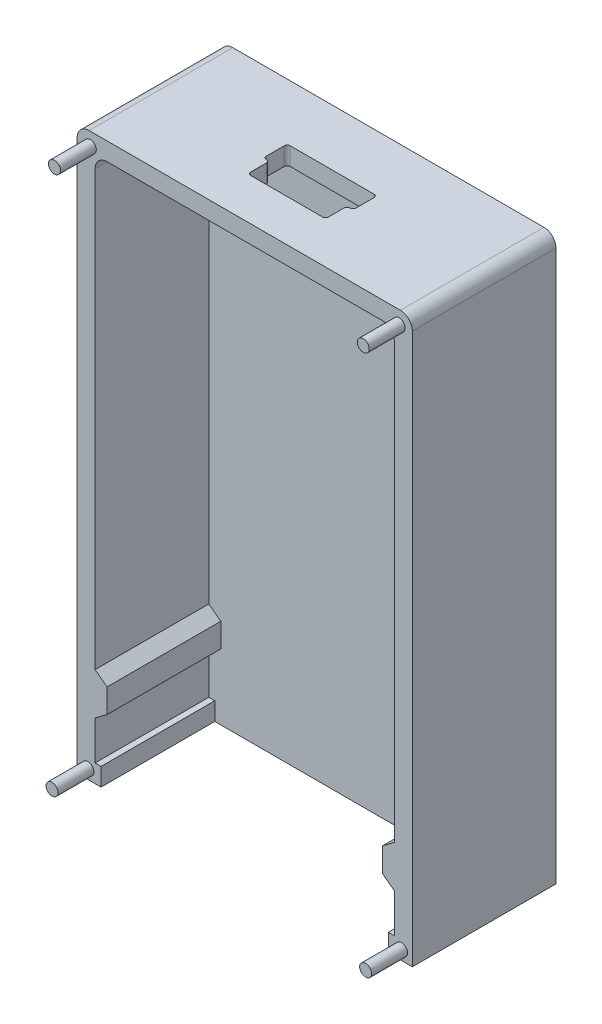
from build123d import *

# Parameters (mm, degrees)
SKIZZE1_W                       = 28
SKIZZE1_H                       = 47
AUFSATZ_LINEAR_AUSTRAGEN1_DEPTH = 12
SCHNITT_LINEAR_AUSTRAGEN1_DEPTH = 9.5
VERRUNDUNG2_R                   = 1
SKIZZE3_R                       = 0.5
AUFSATZ_LINEAR_AUSTRAGEN2_DEPTH = 3
SCHNITT_LINEAR_AUSTRAGEN4_DEPTH = 10
VERRUNDUNG3_R                   = 0.25


with BuildPart() as part:
    # Skizze1 → Aufsatz-Linear austragen1 (new body)
    with BuildSketch(Plane.XY):
        with Locations((14, 23.5)):
            Rectangle(SKIZZE1_W, SKIZZE1_H)
    extrude(amount=AUFSATZ_LINEAR_AUSTRAGEN1_DEPTH)

    # Skizze2 → Schnitt-Linear austragen1 (cut)
    with BuildSketch(Plane.XY.offset(12)):
        with BuildLine():
            Line((2.5, 45.5), (25.5, 45.5))
            ThreePointArc((25.5, 45.5), (26.207106781, 45.207106781), (26.5, 44.5))
            Line((26.5, 44.5), (26.5, 8.251904421))
            Line((26.5, 8.251904421), (25.5, 7.5))
            Line((25.5, 7.5), (25.5, 5.5))
            Line((25.5, 5.5), (26.5, 4.751904421))
            Line((26.5, 4.751904421), (26.5, 1.5))
            Line((26.5, 1.5), (26, 1.5))
            Line((26, 1.5), (26, 0))
            Line((26, 0), (2, 0))
            Line((2, 0), (2, 1.5))
            Line((2, 1.5), (1.5, 1.5))
            Line((1.5, 1.5), (1.5, 4.751904421))
            Line((1.5, 4.751904421), (2.5, 5.5))
            Line((2.5, 5.5), (2.5, 7.5))
            Line((2.5, 7.5), (1.5, 8.251904421))
            Line((1.5, 8.251904421), (1.5, 44.5))
            ThreePointArc((1.5, 44.5), (1.792893219, 45.207106781), (2.5, 45.5))
        make_face()
    extrude(amount=-SCHNITT_LINEAR_AUSTRAGEN1_DEPTH, mode=Mode.SUBTRACT)

    # Verrundung2
    verrundung2_edges = [part.edges().sort_by_distance(p)[0] for p in [
        (0, 47, 6),
        (28, 47, 6),
    ]]
    fillet(verrundung2_edges, radius=VERRUNDUNG2_R)

    # Skizze3 → Aufsatz-Linear austragen2 (add)
    with BuildSketch(Plane.XY.offset(12)):
        with Locations(Location((1.1, 45.9, 0), (0, 0, 180))):
            Circle(SKIZZE3_R)
        with Locations(Location((26.9, 45.9, 0), (0, 0, 180))):
            Circle(SKIZZE3_R)
        with Locations(Location((0.9, 0.8, 0), (0, 0, 180))):
            Circle(SKIZZE3_R)
        with Locations(Location((27.1, 0.8, 0), (0, 0, 180))):
            Circle(SKIZZE3_R)
    extrude(amount=AUFSATZ_LINEAR_AUSTRAGEN2_DEPTH)

    # Skizze4 → Schnitt-Linear austragen4 (cut)
    with BuildSketch(Plane(origin=(0, 47, 0), x_dir=(1, 0, 0), z_dir=(0, 1, 0))):
        Polygon((10.25, -4.7), (10.25, -6.7), (10.75, -6.7), (10.75, -8.5), (17.25, -8.5), (17.25, -6.7), (17.75, -6.7), (17.75, -4.7), align=None)
    extrude(amount=-SCHNITT_LINEAR_AUSTRAGEN4_DEPTH, mode=Mode.SUBTRACT)

    # Verrundung3
    verrundung3_edges = [part.edges().sort_by_distance(p)[0] for p in [
        (17.25, 46.25, 6.7),
        (17.25, 46.25, 8.5),
        (10.75, 46.25, 6.7),
        (10.25, 46.25, 6.7),
        (17.75, 46.25, 6.7),
        (17.75, 46.25, 4.7),
        (10.25, 46.25, 4.7),
        (10.75, 46.25, 8.5),
    ]]
    fillet(verrundung3_edges, radius=VERRUNDUNG3_R - 0.0001)  # a hair under: the kernel refuses the full size


solid = part.part
